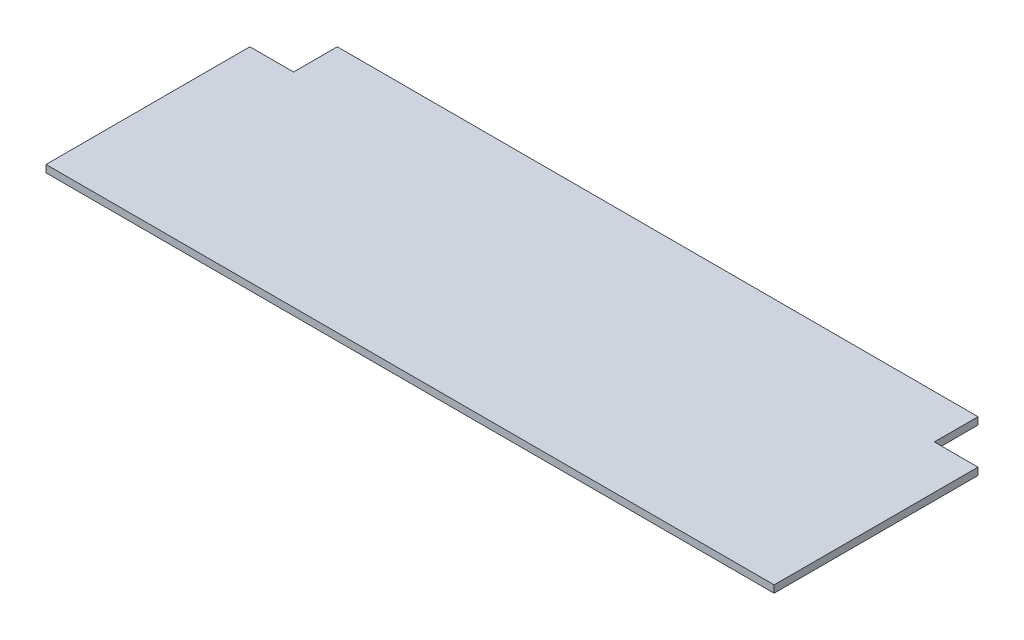
from build123d import *

# Parameters (mm, degrees)
SKETCH1_W           = 635
SKETCH1_H           = 215.9
BOSS_EXTRUDE1_DEPTH = 6.35
SKETCH2_W           = 38.1
SKETCH2_H           = 38.1
CUT_EXTRUDE1_DEPTH  = 671.729552428


with BuildPart() as part:
    # Sketch1 → Boss-Extrude1 (new body)
    with BuildSketch(Plane(origin=(0, 0, 0), x_dir=(1, 0, 0), z_dir=(0, 1, 0))):
        with Locations((317.5, 107.95)):
            Rectangle(SKETCH1_W, SKETCH1_H)
    extrude(amount=BOSS_EXTRUDE1_DEPTH)

    # Sketch2 → Cut-Extrude1 (cut, through all)
    with BuildSketch(Plane(origin=(0, 6.35, 0), x_dir=(1, 0, 0), z_dir=(0, 1, 0))):
        with Locations((19.05, 196.85)):
            Rectangle(SKETCH2_W, SKETCH2_H)
        with Locations((615.95, 196.85)):
            Rectangle(SKETCH2_W, SKETCH2_H)
    extrude(amount=-CUT_EXTRUDE1_DEPTH, mode=Mode.SUBTRACT)


solid = part.part
